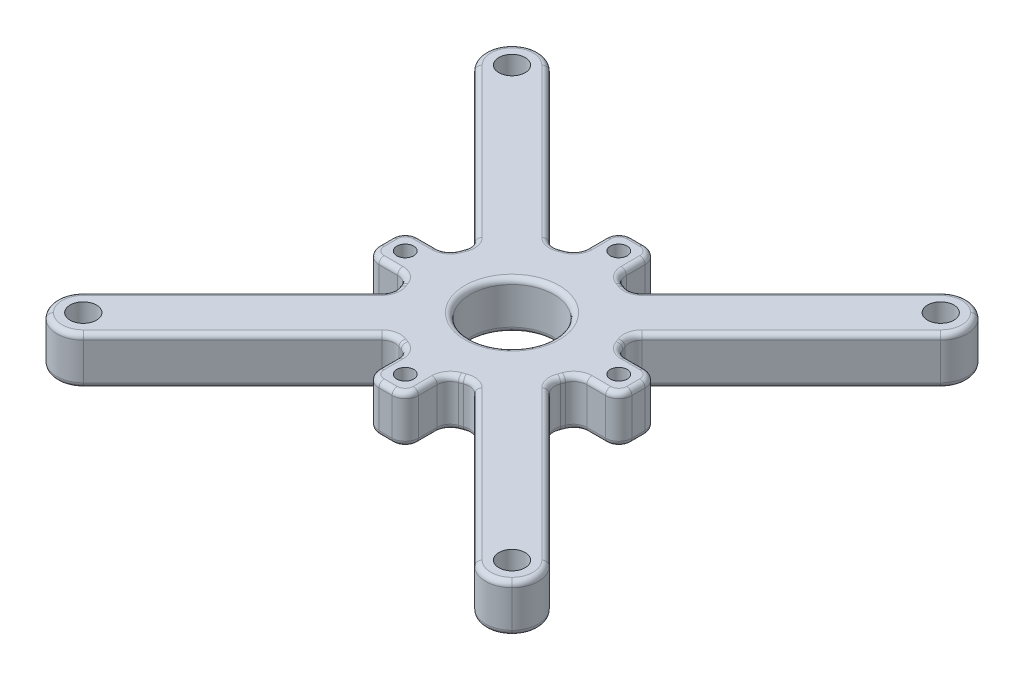
from build123d import *
from build123d.topology import SkipClean

# Parameters (mm, degrees)
GEOMETRY_2_R        = 16.5
GEOMETRY_2_R_2      = 7.9375
GEOMETRY_2_R_3      = 2.75
GEOMETRY_2_R_4      = 1.6
CAP_AND_HOLES_DEPTH = 9
SKETCH1_3_R         = 2.75
SKETCH1_3_R_2       = 1.6
SOCKET_HEAD_DEPTH   = 3
BOSS_EXTRUDE1_START = -9
SKETCH1_R           = 2.5
BOSS_EXTRUDE1_DEPTH = 9
FILLET1_R           = 2.5
FILLET2_R           = 2.5
FILLET3_R           = 5
FILLET4_R           = 1
FILLET5_R           = 1


with BuildPart() as part:
    # Geometry 2 → Cap and Holes (new body)
    # profile 1 of 9: a face of its own
    with BuildSketch(Plane(origin=(0, 0, 0), x_dir=(1, 0, 0), z_dir=(0, 1, 0))):
        Circle(GEOMETRY_2_R)
        with Locations(Location((0, 0, 0), (0, 0, 270))):
            Circle(GEOMETRY_2_R_2, mode=Mode.SUBTRACT)
    # profile 2 of 9: a face of its own
    with BuildSketch(Plane(origin=(0, 0, 0), x_dir=(1, 0, 0), z_dir=(0, 1, 0))):
        with BuildLine():
            ThreePointArc((-16.068213964, -3.75), (-16.5, 0), (-16.068213964, 3.75))
            Line((-16.068213964, 3.75), (-24, 3.75))
            Line((-24, 3.75), (-24, -3.75))
            Line((-24, -3.75), (-16.068213964, -3.75))
        make_face()
        with Locations((-20.25, 0)):
            Circle(GEOMETRY_2_R_3, mode=Mode.SUBTRACT)
    # profile 3 of 9: a face of its own
    with BuildSketch(Plane(origin=(0, 0, 0), x_dir=(1, 0, 0), z_dir=(0, 1, 0))):
        with BuildLine():
            ThreePointArc((3.75, -16.068213964), (0, -16.5), (-3.75, -16.068213964))
            Line((-3.75, -16.068213964), (-3.75, -24))
            Line((-3.75, -24), (3.75, -24))
            Line((3.75, -24), (3.75, -16.068213964))
        make_face()
        with Locations((0, -20.25)):
            Circle(GEOMETRY_2_R_3, mode=Mode.SUBTRACT)
    # profile 4 of 9: a face of its own
    with BuildSketch(Plane(origin=(0, 0, 0), x_dir=(1, 0, 0), z_dir=(0, 1, 0))):
        with BuildLine():
            Line((24, 3.75), (16.068213964, 3.75))
            ThreePointArc((16.068213964, 3.75), (16.391698057, 1.887388353), (16.5, 0))
            ThreePointArc((16.5, 0), (16.391698057, -1.887388353), (16.068213964, -3.75))
            Line((16.068213964, -3.75), (24, -3.75))
            Line((24, -3.75), (24, 3.75))
        make_face()
        with Locations((20.25, 0)):
            Circle(GEOMETRY_2_R_3, mode=Mode.SUBTRACT)
    # profile 5 of 9: a face of its own
    with BuildSketch(Plane(origin=(0, 0, 0), x_dir=(1, 0, 0), z_dir=(0, 1, 0))):
        with BuildLine():
            Line((-3.75, 24), (-3.75, 16.068213964))
            ThreePointArc((-3.75, 16.068213964), (0, 16.5), (3.75, 16.068213964))
            Line((3.75, 16.068213964), (3.75, 24))
            Line((3.75, 24), (-3.75, 24))
        make_face()
        with Locations((0, 20.25)):
            Circle(GEOMETRY_2_R_3, mode=Mode.SUBTRACT)
    # profile 6 of 9: a face of its own
    with BuildSketch(Plane(origin=(0, 0, 0), x_dir=(1, 0, 0), z_dir=(0, 1, 0))):
        with Locations((0, 20.25)):
            Circle(GEOMETRY_2_R_3)
        with Locations(Location((0, 20.25, 0), (0, 0, 270))):
            Circle(GEOMETRY_2_R_4, mode=Mode.SUBTRACT)
    # profile 7 of 9: a face of its own
    with BuildSketch(Plane(origin=(0, 0, 0), x_dir=(1, 0, 0), z_dir=(0, 1, 0))):
        with Locations((-20.25, 0)):
            Circle(GEOMETRY_2_R_3)
        with Locations(Location((-20.25, 0, 0), (0, 0, 270))):
            Circle(GEOMETRY_2_R_4, mode=Mode.SUBTRACT)
    # profile 8 of 9: a face of its own
    with BuildSketch(Plane(origin=(0, 0, 0), x_dir=(1, 0, 0), z_dir=(0, 1, 0))):
        with Locations((0, -20.25)):
            Circle(GEOMETRY_2_R_3)
        with Locations(Location((0, -20.25, 0), (0, 0, 270))):
            Circle(GEOMETRY_2_R_4, mode=Mode.SUBTRACT)
    # profile 9 of 9: a face of its own
    with BuildSketch(Plane(origin=(0, 0, 0), x_dir=(1, 0, 0), z_dir=(0, 1, 0))):
        with Locations((20.25, 0)):
            Circle(GEOMETRY_2_R_3)
        with Locations(Location((20.25, 0, 0), (0, 0, 270))):
            Circle(GEOMETRY_2_R_4, mode=Mode.SUBTRACT)
    extrude(amount=CAP_AND_HOLES_DEPTH)

    # Sketch1<3> → Socket_Head (cut)
    # profile 1 of 4: a face of its own
    with BuildSketch(Plane(origin=(0, 0, 0), x_dir=(1, 0, 0), z_dir=(0, 1, 0))):
        with Locations(Location((0, -20.25, 0), (0, 0, 270))):
            Circle(SKETCH1_3_R)
        with Locations(Location((0, -20.25, 0), (0, 0, 270))):
            Circle(SKETCH1_3_R_2, mode=Mode.SUBTRACT)
    # profile 2 of 4: a face of its own
    with BuildSketch(Plane(origin=(0, 0, 0), x_dir=(1, 0, 0), z_dir=(0, 1, 0))):
        with Locations(Location((20.25, 0, 0), (0, 0, 270))):
            Circle(SKETCH1_3_R)
        with Locations(Location((20.25, 0, 0), (0, 0, 270))):
            Circle(SKETCH1_3_R_2, mode=Mode.SUBTRACT)
    # profile 3 of 4: a face of its own
    with BuildSketch(Plane(origin=(0, 0, 0), x_dir=(1, 0, 0), z_dir=(0, 1, 0))):
        with Locations(Location((0, 20.25, 0), (0, 0, 270))):
            Circle(SKETCH1_3_R)
        with Locations(Location((0, 20.25, 0), (0, 0, 270))):
            Circle(SKETCH1_3_R_2, mode=Mode.SUBTRACT)
    # profile 4 of 4: a face of its own
    with BuildSketch(Plane(origin=(0, 0, 0), x_dir=(1, 0, 0), z_dir=(0, 1, 0))):
        with Locations(Location((-20.25, 0, 0), (0, 0, 270))):
            Circle(SKETCH1_3_R)
        with Locations(Location((-20.25, 0, 0), (0, 0, 270))):
            Circle(SKETCH1_3_R_2, mode=Mode.SUBTRACT)
    extrude(amount=SOCKET_HEAD_DEPTH, mode=Mode.SUBTRACT)

    # Sketch1 → Boss-Extrude1 (add)
    # profile 1 of 8: a face of its own
    with SkipClean():  # the faces are left unmerged after this step: merging them gives an invalid solid
        with BuildSketch(Plane(origin=(0, 9, 0), x_dir=(1, 0, 0), z_dir=(0, 1, 0)).offset(BOSS_EXTRUDE1_START)):
            with BuildLine():
                Line((-40.658639918, 47.72970773), (-47.72970773, 40.658639918))
                Line((-47.72970773, 40.658639918), (-14.654211885, 7.583144073))
                ThreePointArc((-14.654211885, 7.583144073), (-11.66726189, 11.66726189), (-7.583144073, 14.654211885))
                Line((-7.583144073, 14.654211885), (-40.658639918, 47.72970773))
            make_face()
            with Locations(Location((-40.658639918, 40.658639918, 0), (0, 0, 270))):
                Circle(SKETCH1_R, mode=Mode.SUBTRACT)
        # profile 2 of 8: a face of its own
        with BuildSketch(Plane(origin=(0, 9, 0), x_dir=(1, 0, 0), z_dir=(0, 1, 0)).offset(BOSS_EXTRUDE1_START)):
            with BuildLine():
                Line((40.658639918, 47.72970773), (7.583144073, 14.654211885))
                ThreePointArc((7.583144073, 14.654211885), (11.66726189, 11.66726189), (14.654211885, 7.583144073))
                Line((14.654211885, 7.583144073), (47.72970773, 40.658639918))
                Line((47.72970773, 40.658639918), (40.658639918, 47.72970773))
            make_face()
            with Locations(Location((40.658639918, 40.658639918, 0), (0, 0, 270))):
                Circle(SKETCH1_R, mode=Mode.SUBTRACT)
        # profile 3 of 8: a face of its own
        with BuildSketch(Plane(origin=(0, 9, 0), x_dir=(1, 0, 0), z_dir=(0, 1, 0)).offset(BOSS_EXTRUDE1_START)):
            with BuildLine():
                ThreePointArc((14.654211885, -7.583144073), (11.66726189, -11.66726189), (7.583144073, -14.654211885))
                Line((7.583144073, -14.654211885), (40.658639918, -47.72970773))
                Line((40.658639918, -47.72970773), (47.72970773, -40.658639918))
                Line((47.72970773, -40.658639918), (14.654211885, -7.583144073))
            make_face()
            with Locations(Location((40.658639918, -40.658639918, 0), (0, 0, 270))):
                Circle(SKETCH1_R, mode=Mode.SUBTRACT)
        # profile 4 of 8: a face of its own
        with BuildSketch(Plane(origin=(0, 9, 0), x_dir=(1, 0, 0), z_dir=(0, 1, 0)).offset(BOSS_EXTRUDE1_START)):
            with BuildLine():
                ThreePointArc((-7.583144073, -14.654211885), (-11.66726189, -11.66726189), (-14.654211885, -7.583144073))
                Line((-14.654211885, -7.583144073), (-47.72970773, -40.658639918))
                Line((-47.72970773, -40.658639918), (-40.658639918, -47.72970773))
                Line((-40.658639918, -47.72970773), (-7.583144073, -14.654211885))
            make_face()
            with Locations(Location((-40.658639918, -40.658639918, 0), (0, 0, 270))):
                Circle(SKETCH1_R, mode=Mode.SUBTRACT)
        # profile 5 of 8: a face of its own
        with BuildSketch(Plane(origin=(0, 9, 0), x_dir=(1, 0, 0), z_dir=(0, 1, 0)).offset(BOSS_EXTRUDE1_START)):
            with BuildLine():
                ThreePointArc((-7.583144073, 14.654211885), (-11.66726189, 11.66726189), (-14.654211885, 7.583144073))
                Line((-14.654211885, 7.583144073), (-7.894656883, 0.823589071))
                ThreePointArc((-7.894656883, 0.823589071), (-5.612660076, 5.612660076), (-0.823589071, 7.894656883))
                Line((-0.823589071, 7.894656883), (-7.583144073, 14.654211885))
            make_face()
        # profile 6 of 8: a face of its own
        with BuildSketch(Plane(origin=(0, 9, 0), x_dir=(1, 0, 0), z_dir=(0, 1, 0)).offset(BOSS_EXTRUDE1_START)):
            with BuildLine():
                Line((7.583144073, 14.654211885), (0.823589071, 7.894656883))
                ThreePointArc((0.823589071, 7.894656883), (5.612660076, 5.612660076), (7.894656883, 0.823589071))
                Line((7.894656883, 0.823589071), (14.654211885, 7.583144073))
                ThreePointArc((14.654211885, 7.583144073), (11.66726189, 11.66726189), (7.583144073, 14.654211885))
            make_face()
        # profile 7 of 8: a face of its own
        with BuildSketch(Plane(origin=(0, 9, 0), x_dir=(1, 0, 0), z_dir=(0, 1, 0)).offset(BOSS_EXTRUDE1_START)):
            with BuildLine():
                ThreePointArc((7.894656883, -0.823589071), (5.612660076, -5.612660076), (0.823589071, -7.894656883))
                Line((0.823589071, -7.894656883), (7.583144073, -14.654211885))
                ThreePointArc((7.583144073, -14.654211885), (11.66726189, -11.66726189), (14.654211885, -7.583144073))
                Line((14.654211885, -7.583144073), (7.894656883, -0.823589071))
            make_face()
        # profile 8 of 8: a face of its own
        with BuildSketch(Plane(origin=(0, 9, 0), x_dir=(1, 0, 0), z_dir=(0, 1, 0)).offset(BOSS_EXTRUDE1_START)):
            with BuildLine():
                ThreePointArc((-0.823589071, -7.894656883), (-5.612660076, -5.612660076), (-7.894656883, -0.823589071))
                Line((-7.894656883, -0.823589071), (-14.654211885, -7.583144073))
                ThreePointArc((-14.654211885, -7.583144073), (-11.66726189, -11.66726189), (-7.583144073, -14.654211885))
                Line((-7.583144073, -14.654211885), (-0.823589071, -7.894656883))
            make_face()
        extrude(amount=BOSS_EXTRUDE1_DEPTH)

    # Fillet1
    fillet1_edges = [part.edges().sort_by_distance(p)[0] for p in [
        (-7.583144073, 4.5, 14.654211885),
        (-14.654211885, 4.5, 7.583144073),
        (7.583144073, 4.5, 14.654211885),
        (14.654211885, 4.5, 7.583144073),
        (14.654211885, 4.5, -7.583144073),
        (7.583144073, 4.5, -14.654211885),
        (-7.583144073, 4.5, -14.654211885),
        (-14.654211885, 4.5, -7.583144073),
        (3.75, 4.5, 16.068213964),
        (-3.75, 4.5, 16.068213964),
        (-16.068213964, 4.5, 3.75),
        (-16.068213964, 4.5, -3.75),
        (-3.75, 4.5, -16.068213964),
        (3.75, 4.5, -16.068213964),
        (16.068213964, 4.5, -3.75),
        (16.068213964, 4.5, 3.75),
    ]]
    fillet(fillet1_edges, radius=FILLET1_R)

    # Fillet2
    fillet2_edges = [part.edges().sort_by_distance(p)[0] for p in [
        (3.75, 4.5, 24),
        (-3.75, 4.5, 24),
        (-24, 4.5, 3.75),
        (-24, 4.5, -3.75),
        (-3.75, 4.5, -24),
        (3.75, 4.5, -24),
        (24, 4.5, -3.75),
        (24, 4.5, 3.75),
    ]]
    fillet(fillet2_edges, radius=FILLET2_R)

    # Fillet3
    fillet3_edges = [part.edges().sort_by_distance(p)[0] for p in [
        (47.72970773, 4.5, -40.658639918),
        (40.658639918, 4.5, -47.72970773),
        (-40.658639918, 4.5, -47.72970773),
        (-47.72970773, 4.5, -40.658639918),
        (-47.72970773, 4.5, 40.658639918),
        (-40.658639918, 4.5, 47.72970773),
        (47.72970773, 4.5, 40.658639918),
        (40.658639918, 4.5, 47.72970773),
    ]]
    fillet(fillet3_edges, radius=FILLET3_R - 0.0001)  # a hair under: the kernel refuses the full size

    # Fillet4
    fillet4_edges = [part.edges().sort_by_distance(p)[0] for p in [
        (-19.721308433, 0, -3.75),
        (-19.721308433, 9, -3.75),
        (-15.457342241, 9, -5.772397321),
        (-15.457342241, 0, -5.772397321),
        (-30.036902668, 0, -22.965834856),
        (-5.772397321, 0, -15.457342241),
        (-5.772397321, 9, -15.457342241),
        (-22.965834856, 9, -30.036902668),
        (3.75, 0, -19.721308433),
        (3.75, 9, -19.721308433),
        (5.772397321, 0, -15.457342241),
        (5.772397321, 9, -15.457342241),
        (22.965834856, 9, -30.036902668),
        (15.457342241, 9, -5.772397321),
        (15.457342241, 0, -5.772397321),
        (30.036902668, 0, -22.965834856),
        (15.457342241, 9, 5.772397321),
        (15.457342241, 0, 5.772397321),
        (30.036902668, 0, 22.965834856),
        (19.721308433, 0, 3.75),
        (19.721308433, 9, 3.75),
        (5.772397321, 0, 15.457342241),
        (5.772397321, 9, 15.457342241),
        (22.965834856, 9, 30.036902668),
        (-3.75, 0, 19.721308433),
        (-3.75, 9, 19.721308433),
        (-5.772397321, 0, 15.457342241),
        (-5.772397321, 9, 15.457342241),
        (-22.965834856, 9, 30.036902668),
        (-30.036902668, 0, 22.965834856),
        (-15.457342241, 9, 5.772397321),
        (-15.457342241, 0, 5.772397321),
        (-16.49450103, 0, -4.212118618),
        (-16.49450103, 9, -4.212118618),
        (-15.198607283, 0, -7.544479995),
        (-15.198607283, 9, -7.544479995),
        (-7.544479995, 9, -15.198607283),
        (-7.544479995, 0, -15.198607283),
        (-4.212118618, 0, -16.49450103),
        (-4.212118618, 9, -16.49450103),
        (4.212118618, 0, -16.49450103),
        (4.212118618, 9, -16.49450103),
        (7.544479995, 9, -15.198607283),
        (7.544479995, 0, -15.198607283),
        (16.49450103, 0, -4.212118618),
        (16.49450103, 9, -4.212118618),
        (15.198607283, 0, -7.544479995),
        (15.198607283, 9, -7.544479995),
        (15.198607283, 0, 7.544479995),
        (15.198607283, 9, 7.544479995),
        (16.49450103, 0, 4.212118618),
        (16.49450103, 9, 4.212118618),
        (4.212118618, 0, 16.49450103),
        (4.212118618, 9, 16.49450103),
        (7.544479995, 9, 15.198607283),
        (7.544479995, 0, 15.198607283),
        (-4.212118618, 0, 16.49450103),
        (-4.212118618, 9, 16.49450103),
        (-7.544479995, 9, 15.198607283),
        (-7.544479995, 0, 15.198607283),
        (-15.198607283, 0, 7.544479995),
        (-15.198607283, 9, 7.544479995),
        (-16.49450103, 0, 4.212118618),
        (-16.49450103, 9, 4.212118618),
        (-19.721308433, 0, 3.75),
        (-19.721308433, 9, 3.75),
        (-24, 0, 0),
        (-3.75, 0, -19.721308433),
        (0, 0, -24),
        (19.721308433, 0, -3.75),
        (24, 0, 0),
        (3.75, 0, 19.721308433),
        (0, 0, 24),
        (-3.017766953, 0, 23.267766953),
        (3.017766953, 0, 23.267766953),
        (23.267766953, 0, 3.017766953),
        (23.267766953, 0, -3.017766953),
        (3.017766953, 0, -23.267766953),
        (-3.017766953, 0, -23.267766953),
        (-23.267766953, 0, -3.017766953),
        (-23.267766953, 0, 3.017766953),
        (-24, 9, 0),
        (0, 9, 24),
        (3.75, 9, 19.721308433),
        (24, 9, 0),
        (19.721308433, 9, -3.75),
        (0, 9, -24),
        (-3.75, 9, -19.721308433),
        (-3.017766953, 9, 23.267766953),
        (3.017766953, 9, 23.267766953),
        (23.267766953, 9, 3.017766953),
        (23.267766953, 9, -3.017766953),
        (3.017766953, 9, -23.267766953),
        (-3.017766953, 9, -23.267766953),
        (-23.267766953, 9, -3.017766953),
        (-23.267766953, 9, 3.017766953),
        (30.036902668, 9, -22.965834856),
        (-30.036902668, 9, 22.965834856),
        (30.036902668, 9, 22.965834856),
        (-30.036902668, 9, -22.965834856),
        (40.658639918, 9, 45.65868134),
        (45.65868134, 9, 40.658639918),
        (-40.658639918, 9, 45.65868134),
        (-45.65868134, 9, 40.658639918),
        (-45.65868134, 9, -40.658639918),
        (-40.658639918, 9, -45.65868134),
        (40.658639918, 9, -45.65868134),
        (45.65868134, 9, -40.658639918),
        (-22.965834856, 0, -30.036902668),
        (22.965834856, 0, -30.036902668),
        (22.965834856, 0, 30.036902668),
        (-22.965834856, 0, 30.036902668),
        (40.658639918, 0, 45.65868134),
        (45.65868134, 0, 40.658639918),
        (-40.658639918, 0, 45.65868134),
        (-45.65868134, 0, 40.658639918),
        (-45.65868134, 0, -40.658639918),
        (-40.658639918, 0, -45.65868134),
        (40.658639918, 0, -45.65868134),
        (45.65868134, 0, -40.658639918),
    ]]
    fillet(fillet4_edges, radius=FILLET4_R - 0.0001)  # a hair under: the kernel refuses the full size

    # Fillet5
    fillet5_edges = [part.edges().sort_by_distance(p)[0] for p in [
        (0.412351334, 9, 7.926781984),
        (0.412351334, 0, 7.926781984),
    ]]
    fillet(fillet5_edges, radius=FILLET5_R)


solid = part.part
